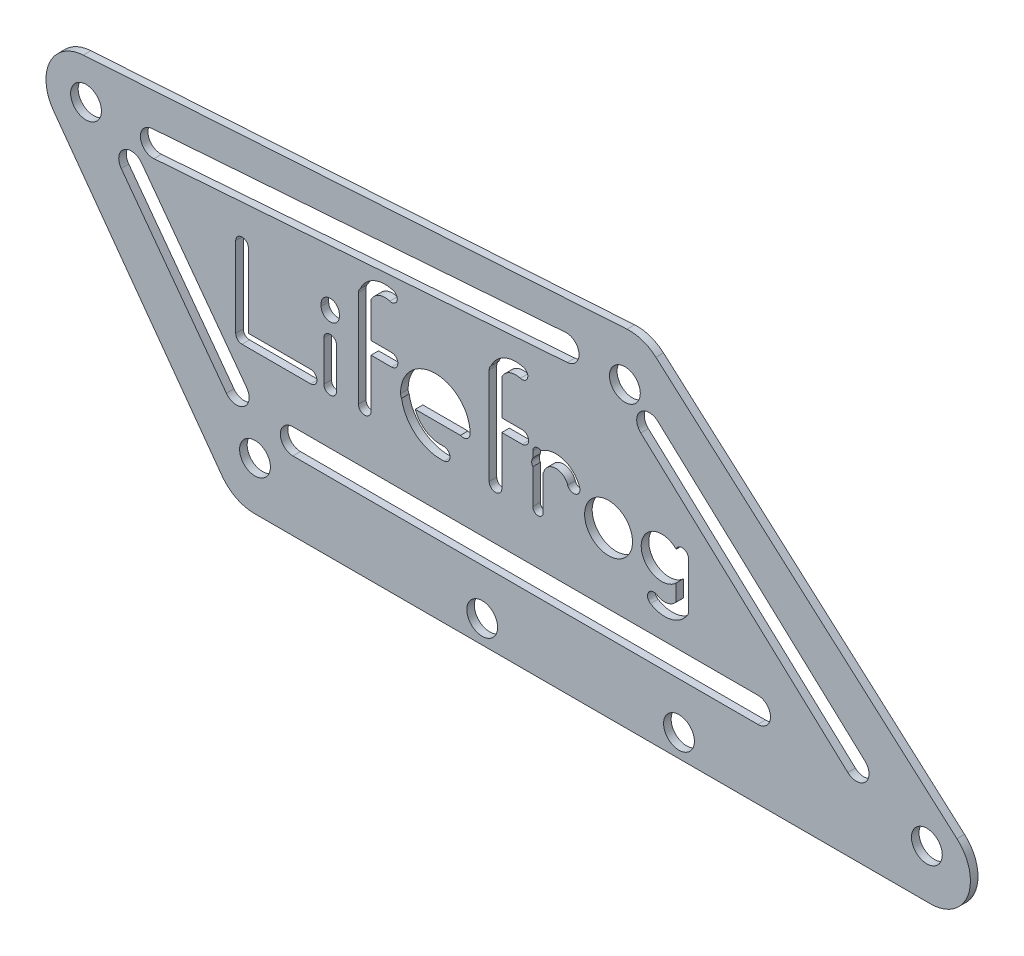
from build123d import *

# Parameters (mm, degrees)
SKETCH3_R              = 3.05
BOSS_EXTRUDE2_DEPTH    = 1.5
CUT_EXTRUDE6_START     = -1.5
CUT_EXTRUDE6_OUTLINE_R = 4.740417633
CUT_EXTRUDE6_DEPTH     = 1.5
SKETCH5_W              = 8.82084455
SKETCH5_H              = 4.027479235
CUT_EXTRUDE7_DEPTH     = 10


# Read off the part's stored shape, not the designer's step: Cut-Extrude6
with BuildPart() as part:
    # Sketch3 → Boss-Extrude2 (new body)
    with BuildSketch(Plane.XY):
        with BuildLine():
            ThreePointArc((-144.781757924, 51.155253196), (-145.537646541, 59.145084312), (-138.901541854, 63.658495821))
            Line((-138.901541854, 63.658495821), (-31.27763344, 70.484200927))
            ThreePointArc((-31.27763344, 70.484200927), (-28.219469087, 70.073170265), (-25.553222822, 68.519965104))
            Line((-25.553222822, 68.519965104), (34.035282129, 15.788374442))
            ThreePointArc((34.035282129, 15.788374442), (36.183192103, 7.089603476), (28.809941074, 1.998699544))
            Line((28.809941074, 1.998699544), (-105.054427768, 1.998699544))
            ThreePointArc((-105.054427768, 1.998699544), (-108.634306546, 2.858213585), (-111.433713401, 5.24936764))
            Line((-111.433713401, 5.24936764), (-144.781757924, 51.155253196))
        make_face()
        with Locations((-138.361865478, 55.847842692)):
            Circle(SKETCH3_R, mode=Mode.SUBTRACT)
        with Locations((-31.700427911, 60.789445495)):
            Circle(SKETCH3_R, mode=Mode.SUBTRACT)
        with Locations((28.072435844, 11.548553432)):
            Circle(SKETCH3_R, mode=Mode.SUBTRACT)
        with Locations((-20.994102553, 6.497064076)):
            Circle(SKETCH3_R, mode=Mode.SUBTRACT)
        with Locations((-104.914769783, 11.544420828)):
            Circle(SKETCH3_R, mode=Mode.SUBTRACT)
        with Locations((-59.942900407, 6.552260768)):
            Circle(SKETCH3_R, mode=Mode.SUBTRACT)
    extrude(amount=BOSS_EXTRUDE2_DEPTH)

    # Cut-Extrude6 outline → Cut-Extrude6 (cut)
    # profile 1 of 13: a face of its own
    with BuildSketch(Plane.XY.offset(1.5).offset(CUT_EXTRUDE6_START)):
        with BuildLine():
            Line((-84.445801199, 50.15994926), (-84.445801199, 31.042182393))
            ThreePointArc((-84.445801199, 31.042182393), (-83.195801199, 29.792182393), (-81.945801199, 31.042182393))
            Line((-81.945801199, 31.042182393), (-81.945801199, 40.686482216))
            Line((-81.945801199, 40.686482216), (-77.88601609, 40.686482216))
            ThreePointArc((-77.88601609, 40.686482216), (-76.63601609, 41.936482216), (-77.88601609, 43.186482216))
            Line((-77.88601609, 43.186482216), (-81.945801199, 43.186482216))
            Line((-81.945801199, 43.186482216), (-81.945801199, 50.15994926))
            ThreePointArc((-81.945801199, 50.15994926), (-81.946335576, 50.196495881), (-81.947938248, 50.233011255))
            ThreePointArc((-81.947938248, 50.233011255), (-80.383515088, 51.713053047), (-78.232158953, 51.811085227))
            ThreePointArc((-78.232158953, 51.811085227), (-76.807431812, 52.543526642), (-77.539873228, 53.968253783))
            ThreePointArc((-77.539873228, 53.968253783), (-81.355697491, 53.760646802), (-84.061279898, 51.061862018))
            ThreePointArc((-84.061279898, 51.061862018), (-84.345659533, 50.650179628), (-84.445801199, 50.15994926))
        make_face()
    # profile 2 of 13: a face of its own
    with BuildSketch(Plane.XY.offset(1.5).offset(CUT_EXTRUDE6_START)):
        with BuildLine():
            ThreePointArc((-62.332478211, 37.038133865), (-69.220904983, 43.926560636), (-76.109331754, 37.038133865))
            ThreePointArc((-76.109331754, 37.038133865), (-76.058176003, 36.667272281), (-75.908529373, 36.324108893))
            ThreePointArc((-75.908529373, 36.324108893), (-72.970069284, 31.391197022), (-67.463094766, 29.765958923))
            ThreePointArc((-67.463094766, 29.765958923), (-66.325504582, 31.119062235), (-67.678607894, 32.256652419))
            ThreePointArc((-67.678607894, 32.256652419), (-71.037890657, 33.084133952), (-73.196105391, 35.788133865))
            Line((-73.196105391, 35.788133865), (-64.262803866, 35.788133865))
            ThreePointArc((-64.262803866, 35.788133865), (-62.957767021, 35.888279837), (-62.332478211, 37.038133865))
        make_face()
        with BuildLine():
            Line((-65.265046653, 38.288133865), (-73.176763311, 38.288133865))
            ThreePointArc((-73.176763311, 38.288133865), (-69.220904982, 41.18678607), (-65.265046653, 38.288133865))
        make_face(mode=Mode.SUBTRACT)
    # profile 3 of 13: a face of its own
    with BuildSketch(Plane.XY.offset(1.5).offset(CUT_EXTRUDE6_START)):
        with BuildLine():
            Line((-88.226075166, 44.145224769), (-88.226075166, 44.594193262))
            ThreePointArc((-88.226075166, 44.594193262), (-90.027407115, 46.395525211), (-91.828739063, 44.594193262))
            Line((-91.828739063, 44.594193262), (-91.828739063, 44.145224769))
            ThreePointArc((-91.828739063, 44.145224769), (-90.027407115, 42.343892821), (-88.226075166, 44.145224769))
        make_face()
    # profile 4 of 13: a face of its own
    with BuildSketch(Plane.XY.offset(1.5).offset(CUT_EXTRUDE6_START)):
        with BuildLine():
            Line((-91.277407114, 38.985980077), (-91.277407114, 31.042182393))
            ThreePointArc((-91.277407114, 31.042182393), (-90.027407114, 29.792182393), (-88.777407114, 31.042182393))
            Line((-88.777407114, 31.042182393), (-88.777407114, 38.985980077))
            ThreePointArc((-88.777407114, 38.985980077), (-90.027407114, 40.235980077), (-91.277407114, 38.985980077))
        make_face()
    # profile 5 of 13: a face of its own
    with BuildSketch(Plane.XY.offset(1.5).offset(CUT_EXTRUDE6_START)):
        with BuildLine():
            Line((-108.731571495, 46.929777762), (-108.731571495, 31.042182393))
            ThreePointArc((-108.731571495, 31.042182393), (-108.365454972, 30.158298916), (-107.481571495, 29.792182393))
            Line((-107.481571495, 29.792182393), (-93.900874788, 29.792182393))
            ThreePointArc((-93.900874788, 29.792182393), (-92.650874788, 31.042182393), (-93.900874788, 32.292182393))
            Line((-93.900874788, 32.292182393), (-106.231571495, 32.292182393))
            Line((-106.231571495, 32.292182393), (-106.231571495, 46.929777762))
            ThreePointArc((-106.231571495, 46.929777762), (-107.481571495, 48.179777762), (-108.731571495, 46.929777762))
        make_face()
    # profile 6 of 13: a face of its own
    with BuildSketch(Plane.XY.offset(1.5).offset(CUT_EXTRUDE6_START)):
        with BuildLine():
            Line((15.808152073, 20.022138003), (-25.170273903, 57.733292534))
            ThreePointArc((-25.170273903, 57.733292534), (-28.702764122, 57.586619945), (-28.556091534, 54.054129726))
            Line((-28.556091534, 54.054129726), (12.422334441, 16.342975195))
            ThreePointArc((12.422334441, 16.342975195), (15.954824661, 16.489647783), (15.808152073, 20.022138003))
        make_face()
    # profile 7 of 13: a face of its own
    with BuildSketch(Plane.XY.offset(1.5).offset(CUT_EXTRUDE6_START)):
        with Locations((-34.929541807, 34.565020639)):
            Circle(CUT_EXTRUDE6_OUTLINE_R)
    # profile 8 of 13: a face of its own
    with BuildSketch(Plane.XY.offset(1.5).offset(CUT_EXTRUDE6_START)):
        with BuildLine():
            Line((-49.934606866, 40.291363071), (-49.934606866, 39.080866379))
            ThreePointArc((-49.934606866, 39.080866379), (-50.014724328, 38.883482639), (-50.086308054, 38.682846354))
            ThreePointArc((-50.086308054, 38.682846354), (-50.138471301, 38.116841548), (-49.934606866, 37.586255327))
            Line((-49.934606866, 37.586255327), (-49.934606866, 30.732479638))
            ThreePointArc((-49.934606866, 30.732479638), (-48.900263345, 29.698136117), (-47.865919824, 30.732479638))
            Line((-47.865919824, 30.732479638), (-47.865919824, 37.586255327))
            ThreePointArc((-47.865919824, 37.586255327), (-47.779496323, 37.734616672), (-47.714218637, 37.893421375))
            ThreePointArc((-47.714218637, 37.893421375), (-45.371600863, 39.582743631), (-43.02898309, 37.893421375))
            ThreePointArc((-43.02898309, 37.893421375), (-41.448225892, 37.102089156), (-40.656893673, 38.682846354))
            ThreePointArc((-40.656893673, 38.682846354), (-43.855198918, 41.845704884), (-48.296139271, 41.130946672))
            ThreePointArc((-48.296139271, 41.130946672), (-49.371959591, 41.211889644), (-49.934606866, 40.291363071))
        make_face()
    # profile 9 of 13: a face of its own
    with BuildSketch(Plane.XY.offset(1.5).offset(CUT_EXTRUDE6_START)):
        with BuildLine():
            Line((-5.377471622, 20.682556599), (-97.407252706, 20.682556599))
            ThreePointArc((-97.407252706, 20.682556599), (-99.907252706, 18.182556599), (-97.407252706, 15.682556599))
            Line((-97.407252706, 15.682556599), (-5.377471622, 15.682556599))
            ThreePointArc((-5.377471622, 15.682556599), (-2.877471622, 18.182556599), (-5.377471622, 20.682556599))
        make_face()
    # profile 10 of 13: a face of its own
    with BuildSketch(Plane.XY.offset(1.5).offset(CUT_EXTRUDE6_START)):
        with BuildLine():
            Line((-58.566031267, 49.850246505), (-58.566031267, 30.732479638))
            ThreePointArc((-58.566031267, 30.732479638), (-57.316031267, 29.482479638), (-56.066031267, 30.732479638))
            Line((-56.066031267, 30.732479638), (-56.066031267, 40.376779461))
            Line((-56.066031267, 40.376779461), (-52.006246159, 40.376779461))
            ThreePointArc((-52.006246159, 40.376779461), (-50.756246159, 41.626779461), (-52.006246159, 42.876779461))
            Line((-52.006246159, 42.876779461), (-56.066031267, 42.876779461))
            Line((-56.066031267, 42.876779461), (-56.066031267, 49.850246505))
            ThreePointArc((-56.066031267, 49.850246505), (-56.066565644, 49.886793126), (-56.068168316, 49.923308499))
            ThreePointArc((-56.068168316, 49.923308499), (-54.516982153, 51.397692157), (-52.379843678, 51.510052394))
            ThreePointArc((-52.379843678, 51.510052394), (-50.962005268, 52.255741402), (-51.707694277, 53.673579812))
            ThreePointArc((-51.707694277, 53.673579812), (-55.498696573, 53.440732932), (-58.181509966, 50.752159263))
            ThreePointArc((-58.181509966, 50.752159263), (-58.465889601, 50.340476873), (-58.566031267, 49.850246505))
        make_face()
    # profile 11 of 13: a face of its own
    with BuildSketch(Plane.XY.offset(1.5).offset(CUT_EXTRUDE6_START)):
        with BuildLine():
            ThreePointArc((-19.109158417, 37.228945948), (-20.160440416, 38.463049329), (-21.545976267, 37.62132764))
            ThreePointArc((-21.545976267, 37.62132764), (-28.473684687, 34.773889825), (-21.609158417, 31.777337614))
            Line((-21.609158417, 31.777337614), (-21.609158417, 28.503585324))
            ThreePointArc((-21.609158417, 28.503585324), (-23.338369309, 27.48758), (-25.305636032, 27.877834744))
            ThreePointArc((-25.305636032, 27.877834744), (-27.028433091, 27.481639975), (-26.632238322, 25.758842916))
            ThreePointArc((-26.632238322, 25.758842916), (-22.616709193, 25.083359631), (-19.299662504, 27.445128696))
            ThreePointArc((-19.299662504, 27.445128696), (-19.157728042, 27.763371797), (-19.109158417, 28.108429841))
            Line((-19.109158417, 28.108429841), (-19.109158417, 37.228945948))
        make_face()
    # profile 12 of 13: a face of its own
    with BuildSketch(Plane.XY.offset(1.5).offset(CUT_EXTRUDE6_START)):
        with BuildLine():
            Line((-106.559030622, 22.817843613), (-127.379119271, 50.951878316))
            ThreePointArc((-127.379119271, 50.951878316), (-130.875842368, 51.474303034), (-131.398267085, 47.977579937))
            Line((-131.398267085, 47.977579937), (-110.578178436, 19.843545235))
            ThreePointArc((-110.578178436, 19.843545235), (-107.08145534, 19.321120517), (-106.559030622, 22.817843613))
        make_face()
    # profile 13 of 13: a face of its own
    with BuildSketch(Plane.XY.offset(1.5).offset(CUT_EXTRUDE6_START)):
        with BuildLine():
            Line((-43.460107465, 63.853687658), (-125.288821414, 57.876383158))
            ThreePointArc((-125.288821414, 57.876383158), (-127.600047149, 55.20089524), (-124.924559231, 52.889669505))
            Line((-124.924559231, 52.889669505), (-43.095845282, 58.866974005))
            ThreePointArc((-43.095845282, 58.866974005), (-40.784619546, 61.542461923), (-43.460107465, 63.853687658))
        make_face()
    extrude(amount=CUT_EXTRUDE6_DEPTH, mode=Mode.SUBTRACT)

    # Sketch5 → Cut-Extrude7 (cut)
    with BuildSketch(Plane.XY.offset(1.5)):
        with Locations((-69.045310367, 39.34406946)):
            Rectangle(SKETCH5_W, SKETCH5_H)
    extrude(amount=-CUT_EXTRUDE7_DEPTH, mode=Mode.SUBTRACT)


solid = part.part
